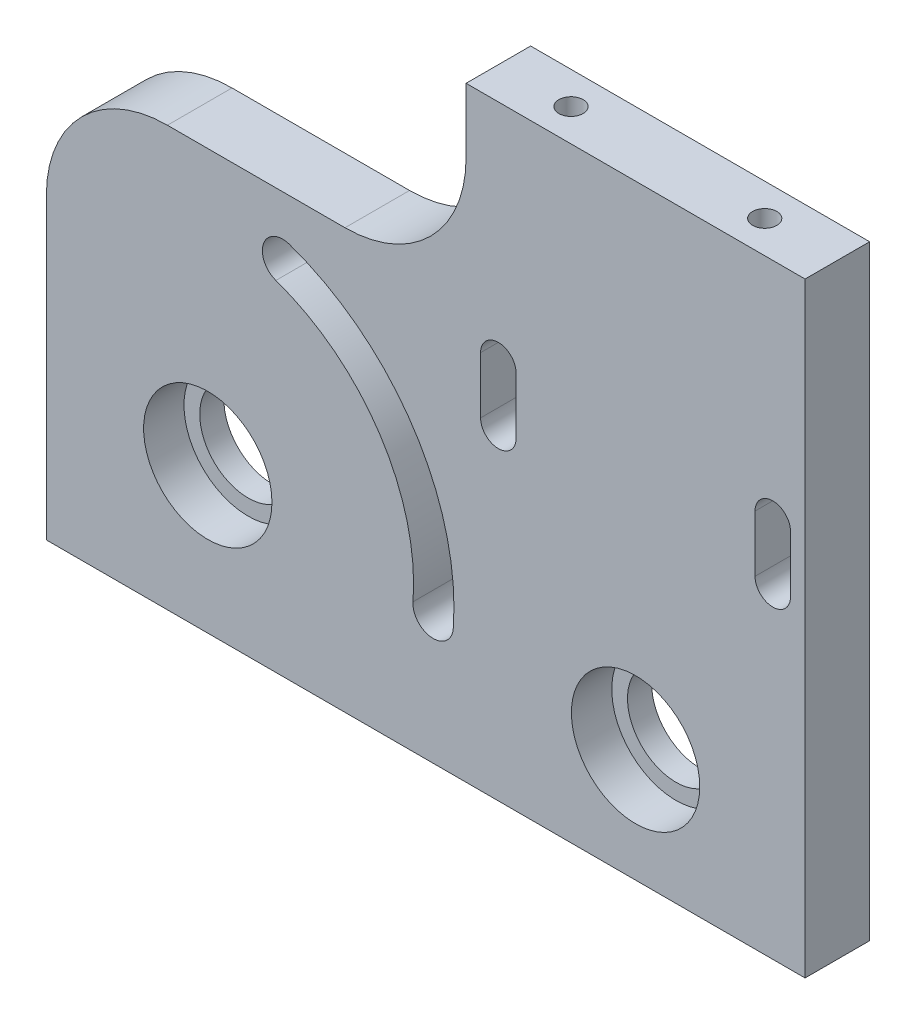
from build123d import *

# Parameters (mm, degrees)
ESQUISSE1_W             = 114.432989691
ESQUISSE1_H             = 75
BOSS_EXTRU_1_DEPTH      = 8
ESQUISSE2_R             = 7.95
ENL_V_MAT_EXTRU_1_DEPTH = 5
ENL_V_MAT_EXTRU_2_REACH = 138.912
ESQUISSE3_R             = 6
ENL_V_MAT_EXTRU_3_DEPTH = 138.05440208
ESQUISSE5_W             = 20.432989691
ESQUISSE5_H             = 75
ENL_V_MAT_EXTRU_4_DEPTH = 138.05440208
ENL_V_MAT_EXTRU_5_DEPTH = 121.519707932
ESQUISSE7_W             = 52
ESQUISSE7_H             = 23
ENL_V_MAT_EXTRU_6_DEPTH = 121.519707932
ESQUISSE10_R            = 1.5
ENL_V_MAT_EXTRU_7_DEPTH = 30
CONG_1_R                = 15
ESQUISSE11_R            = 1.5
ENL_V_MAT_EXTRU_8_DEPTH = 20


with BuildPart() as part:
    # Esquisse1 → Boss.-Extru.1 (new body)
    with BuildSketch(Plane.XY):
        with Locations((57.216494846, 37.5)):
            Rectangle(ESQUISSE1_W, ESQUISSE1_H)
    extrude(amount=BOSS_EXTRU_1_DEPTH)

    # Esquisse2 → Enlèv. mat.-Extru.1 (cut)
    with BuildSketch(Plane.XY.offset(8)):
        with Locations((20, 18)):
            Circle(ESQUISSE2_R)
        with Locations((73, 14)):
            Circle(ESQUISSE2_R)
    extrude(amount=-ENL_V_MAT_EXTRU_1_DEPTH, mode=Mode.SUBTRACT)

    # Esquisse3 → Enlèv. mat.-Extru.2 (cut, up to next)
    with BuildSketch(Plane.XY.offset(3), mode=Mode.PRIVATE) as enl_v_mat_extru_2_sk1:
        with Locations((20, 18)):
            Circle(ESQUISSE3_R)
    enl_v_mat_extru_2_tool1 = extrude(enl_v_mat_extru_2_sk1.sketch, amount=-ENL_V_MAT_EXTRU_2_REACH, mode=Mode.PRIVATE) & part.part
    # Esquisse3 → Enlèv. mat.-Extru.2 (cut, up to next)
    with BuildSketch(Plane.XY.offset(3), mode=Mode.PRIVATE) as enl_v_mat_extru_2_sk2:
        with Locations((73, 14)):
            Circle(ESQUISSE3_R)
    enl_v_mat_extru_2_tool2 = extrude(enl_v_mat_extru_2_sk2.sketch, amount=-ENL_V_MAT_EXTRU_2_REACH, mode=Mode.PRIVATE) & part.part
    add(enl_v_mat_extru_2_tool1.solids().sort_by_distance((20, 18, 3))[0], mode=Mode.SUBTRACT)
    add(enl_v_mat_extru_2_tool2.solids().sort_by_distance((73, 14, 3))[0], mode=Mode.SUBTRACT)

    # Esquisse4 → Enlèv. mat.-Extru.3 (cut, through all)
    with BuildSketch(Plane.XY.offset(8)):
        with BuildLine():
            ThreePointArc((50.413505675, 15.704641081), (45.525982293, 34.69353851), (30.088740957, 46.783107996))
            ThreePointArc((30.088740957, 46.783107996), (26.90252383, 45.250782829), (28.434848997, 42.064565701))
            ThreePointArc((28.434848997, 42.064565701), (41.341395032, 31.956892853), (45.427685072, 16.080929428))
            ThreePointArc((45.427685072, 16.080929428), (47.7324512, 13.399874954), (50.413505675, 15.704641081))
        make_face()
    extrude(amount=-ENL_V_MAT_EXTRU_3_DEPTH, mode=Mode.SUBTRACT)

    # Esquisse5 → Enlèv. mat.-Extru.4 (cut, through all)
    with BuildSketch(Plane.XY.offset(8)):
        with Locations((104.216494845, 37.5)):
            Rectangle(ESQUISSE5_W, ESQUISSE5_H)
    extrude(amount=-ENL_V_MAT_EXTRU_4_DEPTH, mode=Mode.SUBTRACT)

    # Esquisse6 → Enlèv. mat.-Extru.5 (cut, through all)
    with BuildSketch(Plane.XY.offset(8)):
        with BuildLine():
            Line((87.8, 40), (87.8, 47))
            ThreePointArc((87.8, 47), (90, 49.2), (92.2, 47))
            Line((92.2, 47), (92.2, 40))
            ThreePointArc((92.2, 40), (90, 37.8), (87.8, 40))
        make_face()
        with BuildLine():
            Line((58.2, 40), (58.2, 47))
            ThreePointArc((58.2, 47), (56, 49.2), (53.8, 47))
            Line((53.8, 47), (53.8, 40))
            ThreePointArc((53.8, 40), (56, 37.8), (58.2, 40))
        make_face()
    extrude(amount=-ENL_V_MAT_EXTRU_5_DEPTH, mode=Mode.SUBTRACT)

    # Esquisse7 → Enlèv. mat.-Extru.6 (cut, through all)
    with BuildSketch(Plane.XY.offset(8)):
        with Locations((26, 63.5)):
            Rectangle(ESQUISSE7_W, ESQUISSE7_H)
    extrude(amount=-ENL_V_MAT_EXTRU_6_DEPTH, mode=Mode.SUBTRACT)

    # Esquisse10 → Enlèv. mat.-Extru.7 (cut)
    with BuildSketch(Plane(origin=(0, 75, 0), x_dir=(1, 0, 0), z_dir=(0, 1, 0))):
        with Locations((85, -4)):
            Circle(ESQUISSE10_R)
        with Locations((61, -4)):
            Circle(ESQUISSE10_R)
    extrude(amount=-ENL_V_MAT_EXTRU_7_DEPTH, mode=Mode.SUBTRACT)

    # Congé1
    cong_1_edges = [part.edges().sort_by_distance(p)[0] for p in [
        (52, 52, 4),
        (0, 52, 4),
    ]]
    fillet(cong_1_edges, radius=CONG_1_R)

    # Esquisse11 → Enlèv. mat.-Extru.8 (cut)
    with BuildSketch(Plane.XZ):
        with Locations((6, 4)):
            Circle(ESQUISSE11_R)
        with Locations((88, 4)):
            Circle(ESQUISSE11_R)
    extrude(amount=-ENL_V_MAT_EXTRU_8_DEPTH, mode=Mode.SUBTRACT)


solid = part.part
